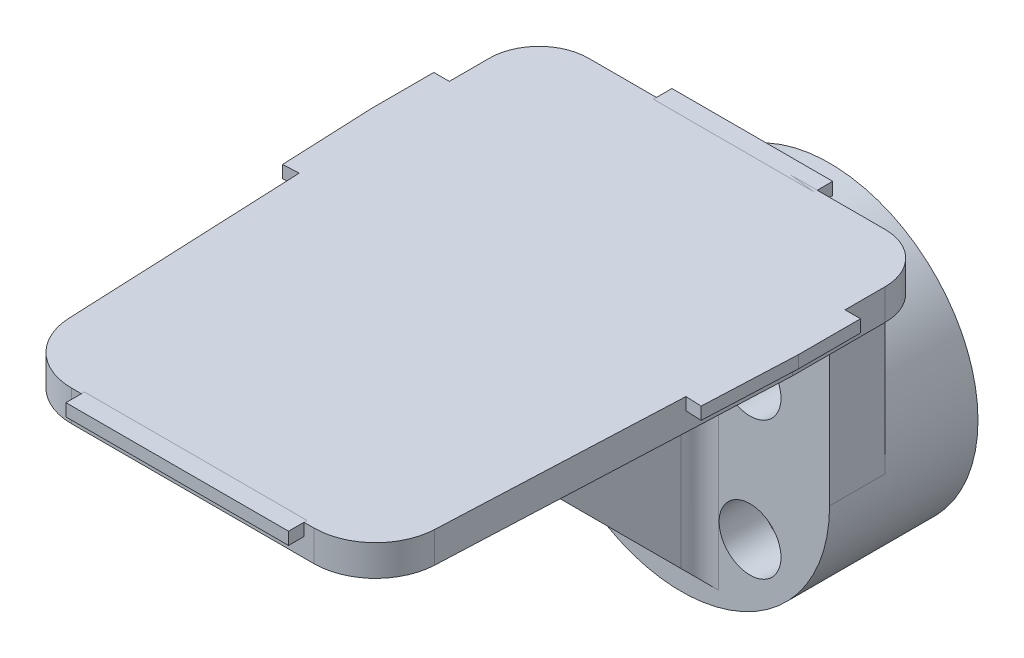
from build123d import *

# Parameters (mm, degrees)
BOSS_EXTRUDE3_DEPTH      = 5
BOSS_EXTRUDE3_DEPTH_BACK = 15
SKETCH1_R                = 24
SKETCH1_R_2              = 20.5
BOSS_EXTRUDE4_DEPTH      = 5
BOSS_EXTRUDE4_DEPTH_BACK = 19
SKETCH1_5_R              = 24
SKETCH1_5_R_2            = 20.5
CUT_EXTRUDE1_DEPTH       = 40.395431207
CUT_EXTRUDE1_DEPTH_BACK  = 40.395431207
SKETCH3_R                = 3
SKETCH7_W                = 36
SKETCH7_H                = 3
BOSS_EXTRUDE6_DEPTH      = 2
SKETCH7_W_2              = 26
BOSS_EXTRUDE6_2_DEPTH    = 2
BOSS_EXTRUDE6_3_DEPTH    = 2
BOSS_EXTRUDE6_4_DEPTH    = 2
BOSS_EXTRUDE7_DEPTH      = 5
BOSS_EXTRUDE8_REACH      = 109.251
BOSS_EXTRUDE8_END_RADIUS = 24
SKETCH8_W                = 48
SKETCH8_H                = 9
BOSS_EXTRUDE9_DEPTH      = 3
BOSS_EXTRUDE9_DEPTH_BACK = 3
FILLET1_R                = 3
SKETCH11_R               = 5
CUT_EXTRUDE3_DEPTH       = 7


with BuildPart() as part:
    # Sketch1 → Boss-Extrude3 (new, two sides: drawn at the far end of the back side and taken through both)
    # profile 1 of 2: a face of its own
    with BuildSketch(Plane.XY.offset(-BOSS_EXTRUDE3_DEPTH_BACK)):
        Circle(SKETCH1_R)
        Circle(SKETCH1_R_2, mode=Mode.SUBTRACT)
    # profile 2 of 2: a face of its own
    with BuildSketch(Plane.XY.offset(-BOSS_EXTRUDE3_DEPTH_BACK)):
        Circle(SKETCH1_R_2)
    extrude(amount=BOSS_EXTRUDE3_DEPTH + BOSS_EXTRUDE3_DEPTH_BACK)

    # Sketch1<5> → Boss-Extrude4 (add, two sides: drawn at the far end of the back side and taken through both)
    with BuildSketch(Plane.XY.offset(-BOSS_EXTRUDE4_DEPTH_BACK)):
        Circle(SKETCH1_5_R)
        Circle(SKETCH1_5_R_2, mode=Mode.SUBTRACT)
    extrude(amount=BOSS_EXTRUDE4_DEPTH + BOSS_EXTRUDE4_DEPTH_BACK)

    # Sketch3 → Cut-Extrude1 (cut, two sides: drawn at the far end of the back side and taken through both)
    with BuildSketch(Plane(origin=(0, 0, -15), x_dir=(-1, 0, 0), z_dir=(0, 0, -1)).offset(-CUT_EXTRUDE1_DEPTH_BACK)):
        with Locations((11.136931804, 11.136931804)):
            Circle(SKETCH3_R)
        with Locations((11.136931804, -11.136931804)):
            Circle(SKETCH3_R)
        with Locations((-11.136931804, -11.136931804)):
            Circle(SKETCH3_R)
        with Locations((-11.136931804, 11.136931804)):
            Circle(SKETCH3_R)
    extrude(amount=CUT_EXTRUDE1_DEPTH + CUT_EXTRUDE1_DEPTH_BACK, mode=Mode.SUBTRACT)



with BuildPart() as body_2:
    # Sketch7 → Boss-Extrude6 (new body)
    with BuildSketch(Plane(origin=(0, 34.2, -5.3), x_dir=(1, 0, 0), z_dir=(0, -1, 0))):
        with Locations((0, 90.3)):
            Rectangle(SKETCH7_W, SKETCH7_H)
    extrude(amount=BOSS_EXTRUDE6_DEPTH)


with BuildPart() as body_3:
    # Sketch7 → Boss-Extrude6 2 (new body)
    with BuildSketch(Plane(origin=(0, 34.2, -5.3), x_dir=(1, 0, 0), z_dir=(0, -1, 0))):
        with Locations((0, 0.3)):
            Rectangle(SKETCH7_W_2, SKETCH7_H)
    extrude(amount=BOSS_EXTRUDE6_2_DEPTH)


with BuildPart() as body_4:
    # Sketch7 → Boss-Extrude6 3 (new body)
    with BuildSketch(Plane(origin=(0, 34.2, -5.3), x_dir=(1, 0, 0), z_dir=(0, -1, 0))):
        Polygon((31.5, 25.8), (30.84570919, 40.785723324), (33.842853854, 40.916581486), (34.5, 25.865460233), (34.5, 15.8), (31.5, 15.8), align=None)
    extrude(amount=BOSS_EXTRUDE6_3_DEPTH)



with BuildPart() as body_5:
    # Sketch7 → Boss-Extrude6 4 (new body)
    with BuildSketch(Plane(origin=(0, 34.2, -5.3), x_dir=(1, 0, 0), z_dir=(0, -1, 0))):
        Polygon((-31.5, 25.8), (-31.5, 15.8), (-34.5, 15.8), (-34.5, 25.865460233), (-33.842853854, 40.916581486), (-30.84570919, 40.785723324), align=None)
    extrude(amount=BOSS_EXTRUDE6_4_DEPTH)


with BuildPart() as body_4_1:
    add(body_4.part)

    add(body_5.part)  # Boss-Extrude7 merges body 5
    # Sketch6 → Boss-Extrude7 (add)
    with BuildSketch(Plane(origin=(0, 34.2, 4.7), x_dir=(1, 0, 0), z_dir=(0, -1, 0))):
        with BuildLine():
            Line((32, -0.7), (32, 14.3))
            Line((32, 14.3), (29.579603504, 69.736193874))
            ThreePointArc((29.579603504, 69.736193874), (26.504251846, 76.523639621), (19.589121288, 79.3))
            Line((19.589121288, 79.3), (-19.589121288, 79.3))
            ThreePointArc((-19.589121288, 79.3), (-26.504251846, 76.523639621), (-29.579603504, 69.736193874))
            Line((-29.579603504, 69.736193874), (-32, 14.3))
            Line((-32, 14.3), (-32, -0.7))
            ThreePointArc((-32, -0.7), (-29.656854249, -6.356854249), (-24, -8.7))
            Line((-24, -8.7), (24, -8.7))
            ThreePointArc((24, -8.7), (29.656854249, -6.356854249), (32, -0.7))
        make_face()
    extrude(amount=BOSS_EXTRUDE7_DEPTH)


with BuildPart() as part_1:
    add(part.part)

    add(body_4_1.part)  # Boss-Extrude8 merges body 4
    # Boss-Extrude8: up to this cylinder (the profile starts outside it)
    boss_extrude8_end = Plane(origin=(0, 0, 0.5), z_dir=(0, 0, 1)) * Cylinder(BOSS_EXTRUDE8_END_RADIUS, 267.502, mode=Mode.PRIVATE)
    # Sketch8 → Boss-Extrude8 (add, up to the surface)
    with BuildSketch(Plane.XZ.offset(-29.2), mode=Mode.PRIVATE) as boss_extrude8_sk1:
        with Locations((0, 0.5)):
            Rectangle(SKETCH8_W, SKETCH8_H)
    boss_extrude8_tool1 = extrude(boss_extrude8_sk1.sketch, amount=BOSS_EXTRUDE8_REACH, mode=Mode.PRIVATE) - boss_extrude8_end
    add(boss_extrude8_tool1.solids().sort_by_distance((0, 29.2, 0.5))[0])

    # Sketch9 → Boss-Extrude9 (add, two sides: drawn at the far end of the back side and taken through both)
    with BuildSketch(Plane(origin=(0, 0, 0), x_dir=(0, 0, -1), z_dir=(1, 0, 0)).offset(-BOSS_EXTRUDE9_DEPTH_BACK)):
        Polygon((-5, 29.2), (-55, 29.2), (-5, -20.8), align=None)
    extrude(amount=BOSS_EXTRUDE9_DEPTH + BOSS_EXTRUDE9_DEPTH_BACK)

    # Fillet1
    # the kernel refuses this fillet: 3 mm, written as the material it adds along each edge
    with BuildSketch(Plane(origin=(-6, 26.2, 8), x_dir=(1, 0, 0), z_dir=(0, 0, -1))) as fillet1_piece_1_section:
        Polygon((0, 0), (FILLET1_R * 1.02, 0), (FILLET1_R * 1.02, -FILLET1_R * 1.02), (0, -FILLET1_R * 1.02), align=None)
    fillet1_piece_1 = extrude(amount=FILLET1_R * 1.02, mode=Mode.PRIVATE)
    fillet1_piece_1 = fillet1_piece_1 - Plane(origin=(-6, 26.2, 8), x_dir=(-0.7071067811865475, -0.7071067811865475, 0), z_dir=(0, 0, -1)) * Sphere(FILLET1_R, mode=Mode.PRIVATE)
    add(fillet1_piece_1)
    with BuildSketch(Plane(origin=(6, 26.2, 8), x_dir=(-1, 0, 0), z_dir=(0, 0, -1))) as fillet1_piece_2_section:
        Polygon((0, 0), (FILLET1_R * 1.02, 0), (FILLET1_R * 1.02, FILLET1_R * 1.02), (0, FILLET1_R * 1.02), align=None)
    fillet1_piece_2 = extrude(amount=FILLET1_R * 1.02, mode=Mode.PRIVATE)
    fillet1_piece_2 = fillet1_piece_2 - Plane(origin=(6, 26.2, 8), x_dir=(0.7071067811865475, -0.7071067811865475, 0), z_dir=(0, 0, -1)) * Sphere(FILLET1_R, mode=Mode.PRIVATE)
    add(fillet1_piece_2)
    with BuildSketch(Plane(origin=(-6, 29.2, 5), x_dir=(0, 0, 1), z_dir=(-1, 0, 0)), Plane(origin=(24, 29.2, 5), x_dir=(0, 0, 1), z_dir=(-1, 0, 0))) as fillet1_piece_3:
        with BuildLine():
            CenterArc((FILLET1_R, -FILLET1_R), FILLET1_R, 90, 90)
            Line((0, -FILLET1_R), (-FILLET1_R * 0.02, -FILLET1_R))
            Line((-FILLET1_R * 0.02, -FILLET1_R), (-FILLET1_R * 0.02, FILLET1_R * 0.02))
            Line((-FILLET1_R * 0.02, FILLET1_R * 0.02), (FILLET1_R, FILLET1_R * 0.02))
            Line((FILLET1_R, FILLET1_R * 0.02), (FILLET1_R, 0))
        make_face()
    extrude(amount=18)
    with BuildSketch(Plane(origin=(24, 29.2, -4), x_dir=(0, -1, 0), z_dir=(0, 0, 1))) as fillet1_piece_4_section:
        with BuildLine():
            CenterArc((FILLET1_R, FILLET1_R), FILLET1_R, 180, 90)
            Line((0, FILLET1_R), (-FILLET1_R * 0.02, FILLET1_R))
            Line((-FILLET1_R * 0.02, FILLET1_R), (-FILLET1_R * 0.02, -FILLET1_R * 0.02))
            Line((-FILLET1_R * 0.02, -FILLET1_R * 0.02), (FILLET1_R, -FILLET1_R * 0.02))
            Line((FILLET1_R, -FILLET1_R * 0.02), (FILLET1_R, 0))
        make_face()
    fillet1_piece_4 = extrude(amount=9, mode=Mode.PRIVATE)
    fillet1_piece_4 = fillet1_piece_4 & Plane(origin=(24, 28.51771495, 4), x_dir=(0, 0, -1), z_dir=(0, 1, 0)) * Cylinder(8, 30, mode=Mode.PRIVATE)
    add(fillet1_piece_4)
    with BuildSketch(Plane(origin=(-24, 29.2, 5), x_dir=(0, -1, 0), z_dir=(0, 0, -1))) as fillet1_piece_5_section:
        with BuildLine():
            CenterArc((FILLET1_R, FILLET1_R), FILLET1_R, 180, 90)
            Line((0, FILLET1_R), (-FILLET1_R * 0.02, FILLET1_R))
            Line((-FILLET1_R * 0.02, FILLET1_R), (-FILLET1_R * 0.02, -FILLET1_R * 0.02))
            Line((-FILLET1_R * 0.02, -FILLET1_R * 0.02), (FILLET1_R, -FILLET1_R * 0.02))
            Line((FILLET1_R, -FILLET1_R * 0.02), (FILLET1_R, 0))
        make_face()
    fillet1_piece_5 = extrude(amount=9, mode=Mode.PRIVATE)
    fillet1_piece_5 = fillet1_piece_5 & Plane(origin=(-24, 28.517715039, 4), x_dir=(-1, 0, 0), z_dir=(0, 1, 0)) * Cylinder(8, 30, mode=Mode.PRIVATE)
    add(fillet1_piece_5)
    with BuildSketch(Plane(origin=(-3, -28.3, 5), x_dir=(-1, 0, 0), z_dir=(0, 1, 0))) as fillet1_piece_6_section:
        with BuildLine():
            CenterArc((FILLET1_R, FILLET1_R), FILLET1_R, 180, 90)
            Line((0, FILLET1_R), (-FILLET1_R * 0.02, FILLET1_R))
            Line((-FILLET1_R * 0.02, FILLET1_R), (-FILLET1_R * 0.02, -FILLET1_R * 0.02))
            Line((-FILLET1_R * 0.02, -FILLET1_R * 0.02), (FILLET1_R, -FILLET1_R * 0.02))
            Line((FILLET1_R, -FILLET1_R * 0.02), (FILLET1_R, 0))
        make_face()
    fillet1_piece_6 = extrude(amount=54.5, mode=Mode.PRIVATE)
    fillet1_piece_6 = split(fillet1_piece_6, bisect_by=Plane(origin=(-3.684520102, -8.5473837, 17.2526163), z_dir=(0, 0.7071067811865475, -0.7071067811865476)), keep=Keep.TOP, mode=Mode.PRIVATE)
    add(fillet1_piece_6)
    with BuildSketch(Plane(origin=(-3, 29.2, 8), x_dir=(-1, 0, 0), z_dir=(0, 0, 1))) as fillet1_piece_7_section:
        with BuildLine():
            CenterArc((FILLET1_R, FILLET1_R), FILLET1_R, 180, 90)
            Line((0, FILLET1_R), (-FILLET1_R * 0.02, FILLET1_R))
            Line((-FILLET1_R * 0.02, FILLET1_R), (-FILLET1_R * 0.02, -FILLET1_R * 0.02))
            Line((-FILLET1_R * 0.02, -FILLET1_R * 0.02), (FILLET1_R, -FILLET1_R * 0.02))
            Line((FILLET1_R, -FILLET1_R * 0.02), (FILLET1_R, 0))
        make_face()
    fillet1_piece_7 = extrude(amount=54.5, mode=Mode.PRIVATE)
    fillet1_piece_7 = split(fillet1_piece_7, bisect_by=Plane(origin=(-3.684520102, 16.9473837, 42.7473837), z_dir=(0, 0.7071067811865475, -0.7071067811865476)), keep=Keep.TOP, mode=Mode.PRIVATE)
    add(fillet1_piece_7)
    with BuildSketch(Plane(origin=(3, -28.3, 5), x_dir=(1, 0, 0), z_dir=(0, 1, 0))) as fillet1_piece_8_section:
        with BuildLine():
            CenterArc((FILLET1_R, -FILLET1_R), FILLET1_R, 90, 90)
            Line((0, -FILLET1_R), (-FILLET1_R * 0.02, -FILLET1_R))
            Line((-FILLET1_R * 0.02, -FILLET1_R), (-FILLET1_R * 0.02, FILLET1_R * 0.02))
            Line((-FILLET1_R * 0.02, FILLET1_R * 0.02), (FILLET1_R, FILLET1_R * 0.02))
            Line((FILLET1_R, FILLET1_R * 0.02), (FILLET1_R, 0))
        make_face()
    fillet1_piece_8 = extrude(amount=54.5, mode=Mode.PRIVATE)
    fillet1_piece_8 = split(fillet1_piece_8, bisect_by=Plane(origin=(3.684520102, -8.5473837, 17.2526163), z_dir=(0, 0.7071067811865475, -0.7071067811865476)), keep=Keep.TOP, mode=Mode.PRIVATE)
    add(fillet1_piece_8)
    with BuildSketch(Plane(origin=(3, 29.2, 8), x_dir=(1, 0, 0), z_dir=(0, 0, 1))) as fillet1_piece_9_section:
        with BuildLine():
            CenterArc((FILLET1_R, -FILLET1_R), FILLET1_R, 90, 90)
            Line((0, -FILLET1_R), (-FILLET1_R * 0.02, -FILLET1_R))
            Line((-FILLET1_R * 0.02, -FILLET1_R), (-FILLET1_R * 0.02, FILLET1_R * 0.02))
            Line((-FILLET1_R * 0.02, FILLET1_R * 0.02), (FILLET1_R, FILLET1_R * 0.02))
            Line((FILLET1_R, FILLET1_R * 0.02), (FILLET1_R, 0))
        make_face()
    fillet1_piece_9 = extrude(amount=54.5, mode=Mode.PRIVATE)
    fillet1_piece_9 = split(fillet1_piece_9, bisect_by=Plane(origin=(3.684520102, 16.9473837, 42.7473837), z_dir=(0, 0.7071067811865475, -0.7071067811865476)), keep=Keep.TOP, mode=Mode.PRIVATE)
    add(fillet1_piece_9)
    with BuildSketch(Plane(origin=(-24, 29.2, 12.5), x_dir=(0, -1, 0), z_dir=(0, 0, -1))) as fillet1_piece_10a_section:
        with BuildLine():
            CenterArc((FILLET1_R, FILLET1_R), FILLET1_R, 180, 90)
            Line((0, FILLET1_R), (-FILLET1_R * 0.02, FILLET1_R))
            Line((-FILLET1_R * 0.02, FILLET1_R), (-FILLET1_R * 0.02, -FILLET1_R * 0.02))
            Line((-FILLET1_R * 0.02, -FILLET1_R * 0.02), (FILLET1_R, -FILLET1_R * 0.02))
            Line((FILLET1_R, -FILLET1_R * 0.02), (FILLET1_R, 0))
        make_face()
    fillet1_piece_10a = extrude(amount=16.5, mode=Mode.PRIVATE)
    fillet1_piece_10a = fillet1_piece_10a & Plane(origin=(-24, 28.516822216, 4), x_dir=(-1, 0, 0), z_dir=(0, 1, 0)) * Cylinder(8, 45, mode=Mode.PRIVATE)
    fillet1_piece_10a = split(fillet1_piece_10a, bisect_by=Plane(origin=(-24.671174744, 28.516822216, 5), z_dir=(0, 0, 1)), keep=Keep.TOP, mode=Mode.PRIVATE)
    with BuildSketch(Plane(origin=(-6, 29.2, 5), x_dir=(0, 0, 1), z_dir=(-1, 0, 0))) as fillet1_piece_10b_section:
        with BuildLine():
            CenterArc((FILLET1_R, -FILLET1_R), FILLET1_R, 90, 90)
            Line((0, -FILLET1_R), (-FILLET1_R * 0.02, -FILLET1_R))
            Line((-FILLET1_R * 0.02, -FILLET1_R), (-FILLET1_R * 0.02, FILLET1_R * 0.02))
            Line((-FILLET1_R * 0.02, FILLET1_R * 0.02), (FILLET1_R, FILLET1_R * 0.02))
            Line((FILLET1_R, FILLET1_R * 0.02), (FILLET1_R, 0))
        make_face()
    fillet1_piece_10b = extrude(amount=25.5, mode=Mode.PRIVATE)
    fillet1_piece_10b = split(fillet1_piece_10b, bisect_by=Plane(origin=(-24, 28.520814657, 5.679185343), z_dir=(-1, 0, 0)), keep=Keep.TOP, mode=Mode.PRIVATE)
    fillet1_piece_10 = fillet1_piece_10a & fillet1_piece_10b
    add(fillet1_piece_10)
    with BuildSketch(Plane(origin=(24, 29.2, -4), x_dir=(0, -1, 0), z_dir=(0, 0, 1))) as fillet1_piece_11a_section:
        with BuildLine():
            CenterArc((FILLET1_R, FILLET1_R), FILLET1_R, 180, 90)
            Line((0, FILLET1_R), (-FILLET1_R * 0.02, FILLET1_R))
            Line((-FILLET1_R * 0.02, FILLET1_R), (-FILLET1_R * 0.02, -FILLET1_R * 0.02))
            Line((-FILLET1_R * 0.02, -FILLET1_R * 0.02), (FILLET1_R, -FILLET1_R * 0.02))
            Line((FILLET1_R, -FILLET1_R * 0.02), (FILLET1_R, 0))
        make_face()
    fillet1_piece_11a = extrude(amount=16.5, mode=Mode.PRIVATE)
    fillet1_piece_11a = fillet1_piece_11a & Plane(origin=(24, 28.516822319, 4), x_dir=(0, 0, -1), z_dir=(0, 1, 0)) * Cylinder(8, 45, mode=Mode.PRIVATE)
    fillet1_piece_11a = split(fillet1_piece_11a, bisect_by=Plane(origin=(24.671175029, 28.516822319, 5), z_dir=(0, 0, 1)), keep=Keep.TOP, mode=Mode.PRIVATE)
    with BuildSketch(Plane(origin=(31.5, 29.2, 5), x_dir=(0, 0, 1), z_dir=(-1, 0, 0))) as fillet1_piece_11b_section:
        with BuildLine():
            CenterArc((FILLET1_R, -FILLET1_R), FILLET1_R, 90, 90)
            Line((0, -FILLET1_R), (-FILLET1_R * 0.02, -FILLET1_R))
            Line((-FILLET1_R * 0.02, -FILLET1_R), (-FILLET1_R * 0.02, FILLET1_R * 0.02))
            Line((-FILLET1_R * 0.02, FILLET1_R * 0.02), (FILLET1_R, FILLET1_R * 0.02))
            Line((FILLET1_R, FILLET1_R * 0.02), (FILLET1_R, 0))
        make_face()
    fillet1_piece_11b = extrude(amount=25.5, mode=Mode.PRIVATE)
    fillet1_piece_11b = split(fillet1_piece_11b, bisect_by=Plane(origin=(24, 28.520814657, 5.679185343), z_dir=(1, 0, 0)), keep=Keep.TOP, mode=Mode.PRIVATE)
    fillet1_piece_11 = fillet1_piece_11a & fillet1_piece_11b
    add(fillet1_piece_11)

    # Sketch11 → Cut-Extrude3 (cut)
    with BuildSketch(Plane.XY.offset(5)):
        with Locations((-11.136931804, 11.136931804)):
            Circle(SKETCH11_R)
        with Locations((11.136931804, 11.136931804)):
            Circle(SKETCH11_R)
        with Locations((-11.136931804, -11.136931804)):
            Circle(SKETCH11_R)
        with Locations((11.136931804, -11.136931804)):
            Circle(SKETCH11_R)
    extrude(amount=-CUT_EXTRUDE3_DEPTH, mode=Mode.SUBTRACT)


solid = Compound([body_2.part, body_3.part, part_1.part])
